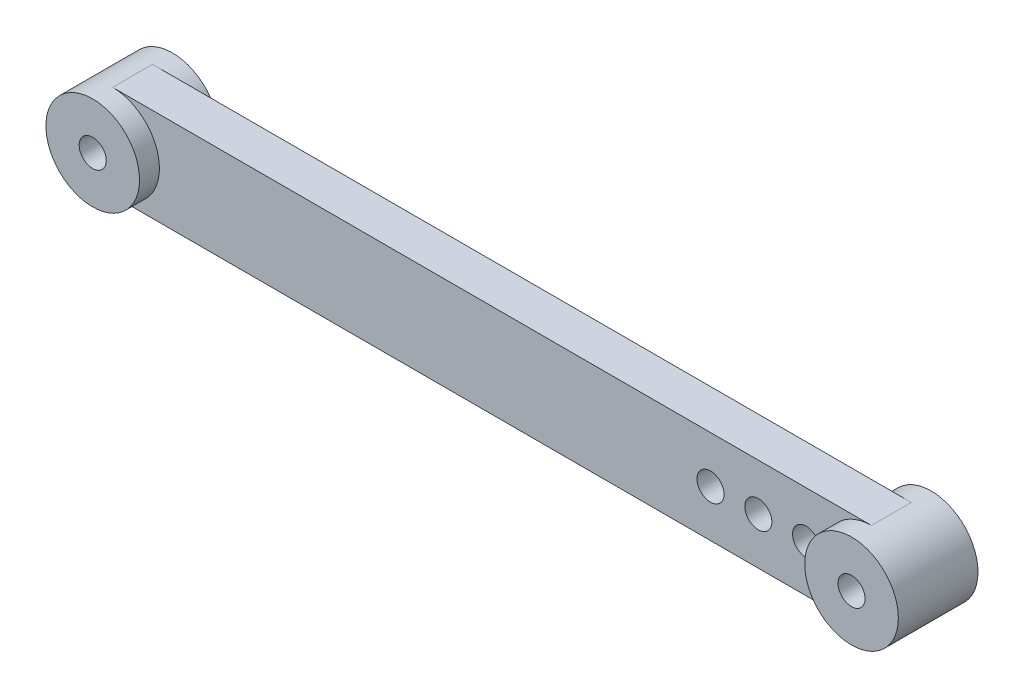
from build123d import *
from build123d.topology import SkipClean

# Parameters (mm, degrees)
BOSS_EXTRUDE1_DEPTH     = 2.5
SKETCH3_R               = 5.875
BOSS_EXTRUDE2_DEPTH     = 5
CUT_EXTRUDE1_DEPTH      = 55.053359054
CUT_EXTRUDE1_DEPTH_BACK = 55.053359054
SKETCH2_R               = 1.7
CUT_EXTRUDE2_DEPTH      = 55.341656443
CUT_EXTRUDE2_DEPTH_BACK = 55.341656443
SKETCH4_R               = 1.7


with BuildPart() as part:
    # Sketch1 → Boss-Extrude1 (new, symmetric)
    with BuildSketch(Plane.XY):
        with BuildLine():
            Line((-47.625, 5.875), (47.625, 5.875))
            ThreePointArc((47.625, 5.875), (53.5, 0), (47.625, -5.875))
            Line((47.625, -5.875), (-47.625, -5.875))
            ThreePointArc((-47.625, -5.875), (-53.5, 0), (-47.625, 5.875))
        make_face()
    extrude(amount=BOSS_EXTRUDE1_DEPTH, both=True)

    # Sketch3 → Boss-Extrude2 (add, symmetric)
    with SkipClean():  # the faces are left unmerged after this step: merging them gives an invalid solid
        with BuildSketch(Plane.XY):
            with Locations((-47.625, 0)):
                Circle(SKETCH3_R)
            with Locations((47.625, 0)):
                Circle(SKETCH3_R)
        extrude(amount=BOSS_EXTRUDE2_DEPTH, both=True)
    add(part.part.scale(1), mode=Mode.REPLACE)  # the faces are merged on a copy

    # Sketch2 → Cut-Extrude1 (cut, two sides: drawn at the far end of the back side and taken through both)
    with BuildSketch(Plane.XY.offset(-CUT_EXTRUDE1_DEPTH_BACK)):
        with Locations((-47.625, 0)):
            Circle(SKETCH2_R)
        with Locations((47.625, 0)):
            Circle(SKETCH2_R)
    extrude(amount=CUT_EXTRUDE1_DEPTH + CUT_EXTRUDE1_DEPTH_BACK, mode=Mode.SUBTRACT)

    # Sketch4 → Cut-Extrude2 (cut, two sides: drawn at the far end of the back side and taken through both)
    with BuildSketch(Plane.XY.offset(2.5).offset(-CUT_EXTRUDE2_DEPTH_BACK)):
        with Locations((33.425, 0)):
            Circle(SKETCH4_R)
        with Locations((27.425, 0)):
            Circle(SKETCH4_R)
        with Locations((39.425, 0)):
            Circle(SKETCH4_R)
    extrude(amount=CUT_EXTRUDE2_DEPTH + CUT_EXTRUDE2_DEPTH_BACK, mode=Mode.SUBTRACT)


solid = part.part
